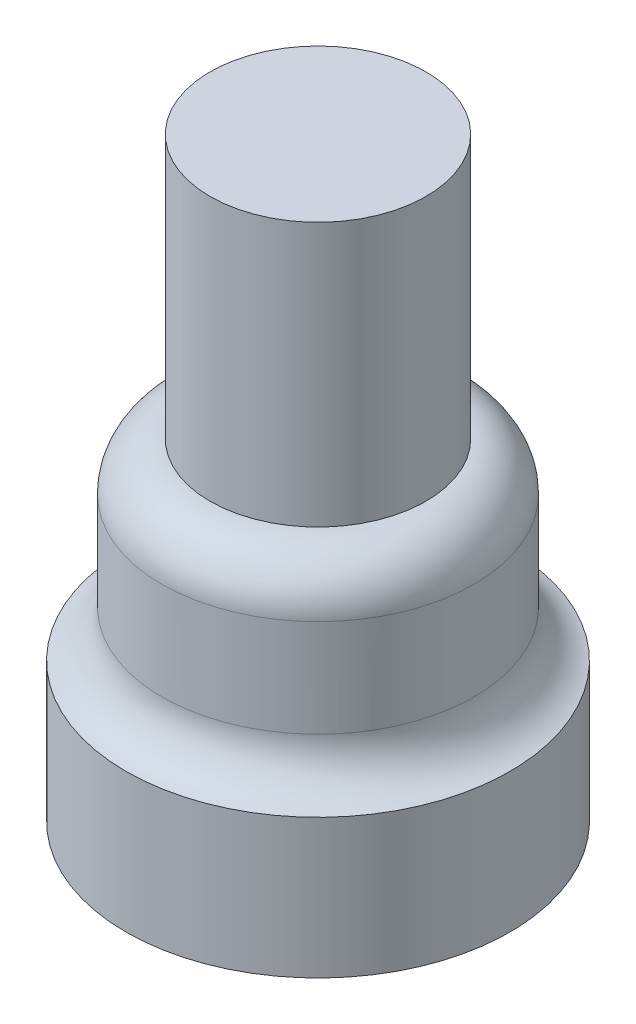
from build123d import *

# Parameters (mm, degrees)
SKETCH1_R           = 8
BOSS_EXTRUDE1_DEPTH = 5.8
SKETCH2_R           = 6.5
BOSS_EXTRUDE2_DEPTH = 8
SKETCH3_R           = 6
CUT_EXTRUDE1_DEPTH  = 5.8
SKETCH4_R           = 4.5
CUT_EXTRUDE2_DEPTH  = 7
SKETCH5_R           = 4.5
BOSS_EXTRUDE3_DEPTH = 11
FILLET1_R           = 2


with BuildPart() as part:
    # Sketch1 → Boss-Extrude1 (new body)
    with BuildSketch(Plane(origin=(0, 0, 0), x_dir=(1, 0, 0), z_dir=(0, 1, 0))):
        with Locations(Location((0, 0, 0), (0, 0, 270))):
            Circle(SKETCH1_R)
    extrude(amount=BOSS_EXTRUDE1_DEPTH)

    # Sketch2 → Boss-Extrude2 (add)
    with BuildSketch(Plane(origin=(0, 5.8, 0), x_dir=(-1, 0, 0), z_dir=(0, 1, 0))):
        with Locations(Location((0, 0, 0), (0, 0, 90))):
            Circle(SKETCH2_R)
    extrude(amount=BOSS_EXTRUDE2_DEPTH)

    # Sketch3 → Cut-Extrude1 (cut)
    with BuildSketch(Plane.XZ):
        with Locations(Location((0, 0, 0), (0, 0, 270))):
            Circle(SKETCH3_R)
    extrude(amount=-CUT_EXTRUDE1_DEPTH, mode=Mode.SUBTRACT)

    # Sketch4 → Cut-Extrude2 (cut)
    with BuildSketch(Plane.XZ.offset(-5.8)):
        with Locations(Location((0, 0, 0), (0, 0, 270))):
            Circle(SKETCH4_R)
    extrude(amount=-CUT_EXTRUDE2_DEPTH, mode=Mode.SUBTRACT)

    # Sketch5 → Boss-Extrude3 (add)
    with BuildSketch(Plane(origin=(0, 13.8, 0), x_dir=(-1, 0, 0), z_dir=(0, 1, 0))):
        with Locations(Location((0, 0, 0), (0, 0, 270))):
            Circle(SKETCH5_R)
    extrude(amount=BOSS_EXTRUDE3_DEPTH)

    # Fillet1
    # the kernel refuses this fillet: 2 mm, written as the material it adds along each edge
    with BuildSketch(Plane(origin=(0, 5.8, 0), x_dir=(0, 0, 1), z_dir=(-1, 0, 0))) as fillet1_piece_1:
        with BuildLine():
            CenterArc((8.5, 1.936491673), FILLET1_R, 180, 75.522487814)
            Line((6.5, 1.936491673), (6.5, 0))
            Line((6.5, 0), (8, 0))
        make_face()
    revolve(axis=Axis((0, 5.8, 0), (0, 1, 0)))
    # the kernel refuses this fillet: 2 mm, written as the material it takes off along each edge
    with BuildSketch(Plane(origin=(0, 13.8, 0), x_dir=(0, 0, 1), z_dir=(-1, 0, 0))) as fillet1_2_piece_1:
        with BuildLine():
            CenterArc((6.5 - FILLET1_R, -FILLET1_R), FILLET1_R, 0, 90)
            Line((6.5 - FILLET1_R, 0), (6.5, 0))
            Line((6.5, 0), (6.5, -FILLET1_R))
        make_face()
    revolve(axis=Axis((0, 13.8, 0), (0, 1, 0)), mode=Mode.SUBTRACT)


solid = part.part
